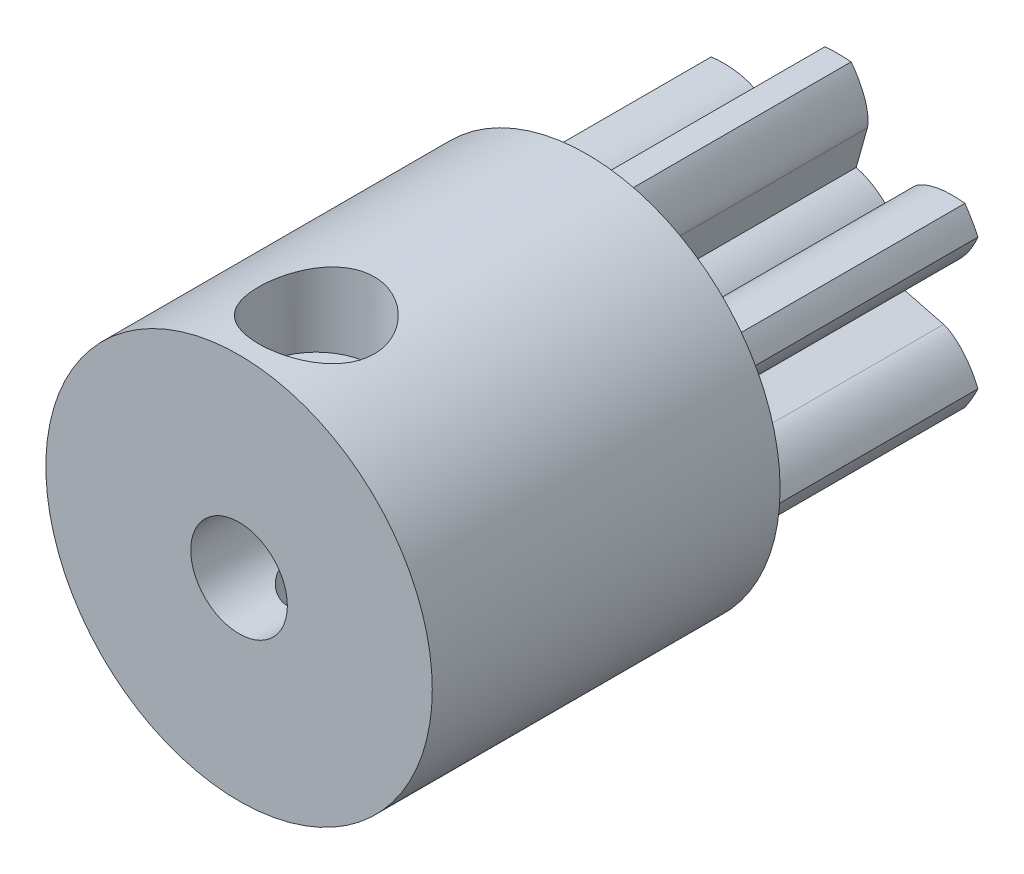
from build123d import *

# Parameters (mm, degrees)
SKETCH_1_R               = 4
SKETCH_1_R_2             = 1.25
EXTRUDE_1_DEPTH          = 6.5
CUT_EXTRUDE_1_DEPTH      = 9.61684397
PATTERN_CIRCULAR_1_DEPTH = 6.5
SKETCH_2_R               = 5
SKETCH_2_R_2             = 1.25
EXTRUDE_2_DEPTH          = 9
EXTRUDE_START            = -6.5
SKETCH_2_4_R             = 1.25
EXTRUDE_3_DEPTH          = 6.5
CUT_EXTRUDE_2_DEPTH      = 18.036725096
CUT_EXTRUDE_2_DEPTH_BACK = 18.036725096
SKETCH_3_R               = 0.75
CUT_EXTRUDE_START        = 5
SKETCH_3_5_R             = 1.5
CUT_EXTRUDE_3_DEPTH      = 2


# Read off the part's stored shape, not the designer's step: 阵列(圆周)1
with BuildPart() as part:
    # 草图1 → 凸台-拉伸1 (new body)
    with BuildSketch(Plane.XY):
        with Locations(Location((0, 0, 0), (0, 0, 180))):
            Circle(SKETCH_1_R)
        with Locations(Location((0, 0, 0), (0, 0, 180))):
            Circle(SKETCH_1_R_2, mode=Mode.SUBTRACT)
    extrude(amount=EXTRUDE_1_DEPTH)

    # 草图1<3> → 切除-拉伸1 (cut, through all)
    with BuildSketch(Plane.XY):
        with BuildLine():
            Line((2.730540893, 0.700961074), (1.695038873, 0.435135863))
            ThreePointArc((1.695038873, 0.435135863), (1.736205349, 0.219296571), (1.75, 0))
            ThreePointArc((1.75, 0), (1.736205349, -0.219296571), (1.695038873, -0.435135863))
            Line((1.695038873, -0.435135863), (2.730540893, -0.700961074))
            add(Edge.make_bspline(
                [(2.730540893, -0.700961074), (2.751355068, -0.706304311), (2.808329953, -0.725541446), (2.910522768, -0.778982289), (3.06267796, -0.887491262), (3.235956594, -1.057334282), (3.408810129, -1.2831446), (3.52264255, -1.482702951), (3.589508983, -1.625182096), (3.620975996, -1.699568426)],
                knots=[0, 0, 0, 0, 0, 0.005604068, 0.015718248, 0.029959916, 0.048733667, 0.068727063, 0.089838728, 0.089838728, 0.089838728, 0.089838728, 0.089838728], degree=4))
            ThreePointArc((3.620975996, -1.699568426), (3.90409426, -0.870659525), (4, 0))
            ThreePointArc((4, 0), (3.90409426, 0.870659525), (3.620975996, 1.699568426))
            add(Edge.make_bspline(
                [(2.730540893, 0.700961074), (2.751355068, 0.706304311), (2.808329953, 0.725541446), (2.910522768, 0.778982289), (3.06267796, 0.887491262), (3.235956594, 1.057334282), (3.408810129, 1.2831446), (3.52264255, 1.482702951), (3.589508983, 1.625182096), (3.620975996, 1.699568426)],
                knots=[0, 0, 0, 0, 0, 0.005604068, 0.015718248, 0.029959916, 0.048733667, 0.068727063, 0.089838728, 0.089838728, 0.089838728, 0.089838728, 0.089838728], degree=4))
        make_face()
    extrude(amount=CUT_EXTRUDE_1_DEPTH, mode=Mode.SUBTRACT)

    # 阵列(圆周)1 outline → 阵列(圆周)1 (cut)
    with BuildSketch(Plane.XY):
        with BuildLine():
            Line((1.224358148, 1.250378793), (1.972320543, 2.014237242))
            add(Edge.make_bspline(
                [(1.972320543, 2.014237242), (1.98735501, 2.029591229), (2.0325023, 2.069314359), (2.129879836, 2.131095511), (2.299928959, 2.208611286), (2.533656646, 2.273753475), (2.815640885, 2.310543869), (3.045379697, 2.309346461), (3.202203473, 2.296014919), (3.282357431, 2.286072986)],
                knots=[0, 0, 0, 0, 0, 0.005604068, 0.015718248, 0.029959916, 0.048733667, 0.068727063, 0.089838728, 0.089838728, 0.089838728, 0.089838728, 0.089838728], degree=4))
            ThreePointArc((3.282357431, 2.286072986), (2, 3.464101615), (0.338618565, 3.985641412))
            add(Edge.make_bspline(
                [(0.758220349, 2.715198316), (0.764000058, 2.735895539), (0.775827653, 2.794855805), (0.780642932, 2.9100778), (0.762749001, 3.096102548), (0.702299948, 3.331087757), (0.593169245, 3.593688469), (0.477262853, 3.792049412), (0.387305511, 3.921197015), (0.338618565, 3.985641412)],
                knots=[0, 0, 0, 0, 0, 0.005604068, 0.015718248, 0.029959916, 0.048733667, 0.068727063, 0.089838728, 0.089838728, 0.089838728, 0.089838728, 0.089838728], degree=4))
            Line((0.758220349, 2.715198316), (0.470680725, 1.685514656))
            ThreePointArc((0.470680725, 1.685514656), (0.875, 1.515544457), (1.224358148, 1.250378793))
        make_face()
        with BuildLine():
            add(Edge.make_bspline(
                [(0.758220349, -2.715198316), (0.764000058, -2.735895539), (0.775827653, -2.794855805), (0.780642932, -2.9100778), (0.762749001, -3.096102548), (0.702299948, -3.331087757), (0.593169245, -3.593688469), (0.477262853, -3.792049412), (0.387305511, -3.921197015), (0.338618565, -3.985641412)],
                knots=[0, 0, 0, 0, 0, 0.005604068, 0.015718248, 0.029959916, 0.048733667, 0.068727063, 0.089838728, 0.089838728, 0.089838728, 0.089838728, 0.089838728], degree=4))
            ThreePointArc((0.338618565, -3.985641412), (2, -3.464101615), (3.282357431, -2.286072986))
            add(Edge.make_bspline(
                [(1.972320543, -2.014237242), (1.98735501, -2.029591229), (2.0325023, -2.069314359), (2.129879836, -2.131095511), (2.299928959, -2.208611286), (2.533656646, -2.273753475), (2.815640885, -2.310543869), (3.045379697, -2.309346461), (3.202203473, -2.296014919), (3.282357431, -2.286072986)],
                knots=[0, 0, 0, 0, 0, 0.005604068, 0.015718248, 0.029959916, 0.048733667, 0.068727063, 0.089838728, 0.089838728, 0.089838728, 0.089838728, 0.089838728], degree=4))
            Line((1.972320543, -2.014237242), (1.224358148, -1.250378793))
            ThreePointArc((1.224358148, -1.250378793), (0.875, -1.515544457), (0.470680725, -1.685514656))
            Line((0.470680725, -1.685514656), (0.758220349, -2.715198316))
        make_face()
        with BuildLine():
            add(Edge.make_bspline(
                [(-1.972320543, -2.014237242), (-1.98735501, -2.029591229), (-2.0325023, -2.069314359), (-2.129879836, -2.131095511), (-2.299928959, -2.208611286), (-2.533656646, -2.273753475), (-2.815640885, -2.310543869), (-3.045379697, -2.309346461), (-3.202203473, -2.296014919), (-3.282357431, -2.286072986)],
                knots=[0, 0, 0, 0, 0, 0.005604068, 0.015718248, 0.029959916, 0.048733667, 0.068727063, 0.089838728, 0.089838728, 0.089838728, 0.089838728, 0.089838728], degree=4))
            ThreePointArc((-3.282357431, -2.286072986), (-2, -3.464101615), (-0.338618565, -3.985641412))
            add(Edge.make_bspline(
                [(-0.758220349, -2.715198316), (-0.764000058, -2.735895539), (-0.775827653, -2.794855805), (-0.780642932, -2.9100778), (-0.762749001, -3.096102548), (-0.702299948, -3.331087757), (-0.593169245, -3.593688469), (-0.477262853, -3.792049412), (-0.387305511, -3.921197015), (-0.338618565, -3.985641412)],
                knots=[0, 0, 0, 0, 0, 0.005604068, 0.015718248, 0.029959916, 0.048733667, 0.068727063, 0.089838728, 0.089838728, 0.089838728, 0.089838728, 0.089838728], degree=4))
            Line((-0.758220349, -2.715198316), (-0.470680725, -1.685514656))
            ThreePointArc((-0.470680725, -1.685514656), (-0.875, -1.515544457), (-1.224358148, -1.250378793))
            Line((-1.224358148, -1.250378793), (-1.972320543, -2.014237242))
        make_face()
        with BuildLine():
            add(Edge.make_bspline(
                [(-2.730540893, 0.700961074), (-2.751355068, 0.706304311), (-2.808329953, 0.725541446), (-2.910522768, 0.778982289), (-3.06267796, 0.887491262), (-3.235956594, 1.057334282), (-3.408810129, 1.2831446), (-3.52264255, 1.482702951), (-3.589508983, 1.625182096), (-3.620975996, 1.699568426)],
                knots=[0, 0, 0, 0, 0, 0.005604068, 0.015718248, 0.029959916, 0.048733667, 0.068727063, 0.089838728, 0.089838728, 0.089838728, 0.089838728, 0.089838728], degree=4))
            ThreePointArc((-3.620975996, 1.699568426), (-4, 0), (-3.620975996, -1.699568426))
            add(Edge.make_bspline(
                [(-2.730540893, -0.700961074), (-2.751355068, -0.706304311), (-2.808329953, -0.725541446), (-2.910522768, -0.778982289), (-3.06267796, -0.887491262), (-3.235956594, -1.057334282), (-3.408810129, -1.2831446), (-3.52264255, -1.482702951), (-3.589508983, -1.625182096), (-3.620975996, -1.699568426)],
                knots=[0, 0, 0, 0, 0, 0.005604068, 0.015718248, 0.029959916, 0.048733667, 0.068727063, 0.089838728, 0.089838728, 0.089838728, 0.089838728, 0.089838728], degree=4))
            Line((-2.730540893, -0.700961074), (-1.695038873, -0.435135863))
            ThreePointArc((-1.695038873, -0.435135863), (-1.75, 0), (-1.695038873, 0.435135863))
            Line((-1.695038873, 0.435135863), (-2.730540893, 0.700961074))
        make_face()
        with BuildLine():
            add(Edge.make_bspline(
                [(-0.758220349, 2.715198316), (-0.764000058, 2.735895539), (-0.775827653, 2.794855805), (-0.780642932, 2.9100778), (-0.762749001, 3.096102548), (-0.702299948, 3.331087757), (-0.593169245, 3.593688469), (-0.477262853, 3.792049412), (-0.387305511, 3.921197015), (-0.338618565, 3.985641412)],
                knots=[0, 0, 0, 0, 0, 0.005604068, 0.015718248, 0.029959916, 0.048733667, 0.068727063, 0.089838728, 0.089838728, 0.089838728, 0.089838728, 0.089838728], degree=4))
            ThreePointArc((-0.338618565, 3.985641412), (-2, 3.464101615), (-3.282357431, 2.286072986))
            add(Edge.make_bspline(
                [(-1.972320543, 2.014237242), (-1.98735501, 2.029591229), (-2.0325023, 2.069314359), (-2.129879836, 2.131095511), (-2.299928959, 2.208611286), (-2.533656646, 2.273753475), (-2.815640885, 2.310543869), (-3.045379697, 2.309346461), (-3.202203473, 2.296014919), (-3.282357431, 2.286072986)],
                knots=[0, 0, 0, 0, 0, 0.005604068, 0.015718248, 0.029959916, 0.048733667, 0.068727063, 0.089838728, 0.089838728, 0.089838728, 0.089838728, 0.089838728], degree=4))
            Line((-1.972320543, 2.014237242), (-1.224358148, 1.250378793))
            ThreePointArc((-1.224358148, 1.250378793), (-0.875, 1.515544457), (-0.470680725, 1.685514656))
            Line((-0.470680725, 1.685514656), (-0.758220349, 2.715198316))
        make_face()
    extrude(amount=PATTERN_CIRCULAR_1_DEPTH, mode=Mode.SUBTRACT)

    # 草图2 → 凸台-拉伸2 (add)
    with BuildSketch(Plane.XY.offset(6.5)):
        Circle(SKETCH_2_R)
        with Locations(Location((0, 0, 0), (0, 0, 180))):
            Circle(SKETCH_2_R_2, mode=Mode.SUBTRACT)
    extrude(amount=EXTRUDE_2_DEPTH)

    # 草图2<4> → 凸台-拉伸3 (add)
    with BuildSketch(Plane.XY.offset(6.5).offset(EXTRUDE_START)):
        with Locations(Location((0, 0, 0), (0, 0, 180))):
            Circle(SKETCH_2_4_R)
    extrude(amount=EXTRUDE_3_DEPTH)

    # 草图3 → 切除-拉伸2 (cut, two sides: drawn at the far end of the back side and taken through both)
    with BuildSketch(Plane(origin=(0, 0, 0), x_dir=(1, 0, 0), z_dir=(0, 1, 0)).offset(-CUT_EXTRUDE_2_DEPTH_BACK)):
        with Locations(Location((0, -13.5, 0), (0, 0, 270))):
            Circle(SKETCH_3_R)
    extrude(amount=CUT_EXTRUDE_2_DEPTH + CUT_EXTRUDE_2_DEPTH_BACK, mode=Mode.SUBTRACT)

    # 草图3<5> → 切除-拉伸3 (cut)
    with BuildSketch(Plane(origin=(0, 0, 0), x_dir=(1, 0, 0), z_dir=(0, 1, 0)).offset(CUT_EXTRUDE_START)):
        with Locations(Location((0, -13.5, 0), (0, 0, 270))):
            Circle(SKETCH_3_5_R)
    extrude(amount=-CUT_EXTRUDE_3_DEPTH, mode=Mode.SUBTRACT)


solid = part.part
